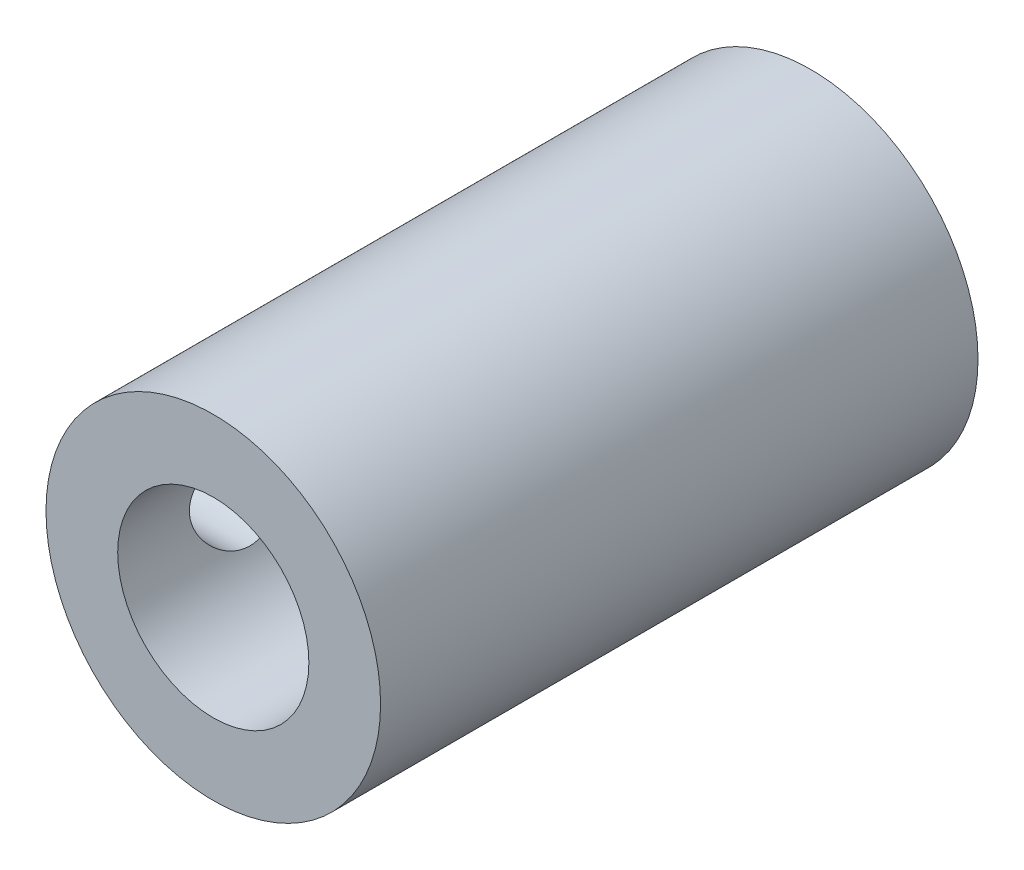
from build123d import *

# Parameters (mm, degrees)
SKETCH1_R           = 7
SKETCH1_R_2         = 3
BOSS_EXTRUDE1_DEPTH = 25
SKETCH2_R           = 4
CUT_EXTRUDE1_DEPTH  = 13
SKETCH3_R           = 2
CUT_EXTRUDE2_DEPTH  = 12
SKETCH5_R           = 2.515559063
CUT_EXTRUDE3_DEPTH  = 1


with BuildPart() as part:
    # Sketch1 → Boss-Extrude1 (new body)
    with BuildSketch(Plane(origin=(0, 0, 0), x_dir=(0, 1, 0), z_dir=(0, 0, 1))):
        Circle(SKETCH1_R)
        Circle(SKETCH1_R_2, mode=Mode.SUBTRACT)
    extrude(amount=BOSS_EXTRUDE1_DEPTH)

    # Sketch2 → Cut-Extrude1 (cut)
    with BuildSketch(Plane.XY.offset(25)):
        Circle(SKETCH2_R)
    extrude(amount=-CUT_EXTRUDE1_DEPTH, mode=Mode.SUBTRACT)

    # Sketch3 → Cut-Extrude2 (cut)
    with BuildSketch(Plane.YZ):
        with Locations((0, 5)):
            Circle(SKETCH3_R)
        with Locations((0, 20)):
            Circle(SKETCH3_R)
    extrude(amount=-CUT_EXTRUDE2_DEPTH, mode=Mode.SUBTRACT)

    # Sketch5 → Cut-Extrude3 (cut)
    with BuildSketch(Plane.ZY.offset(7)):
        with Locations((5, 0)):
            Circle(SKETCH5_R)
    extrude(amount=-CUT_EXTRUDE3_DEPTH, mode=Mode.SUBTRACT)


solid = part.part
